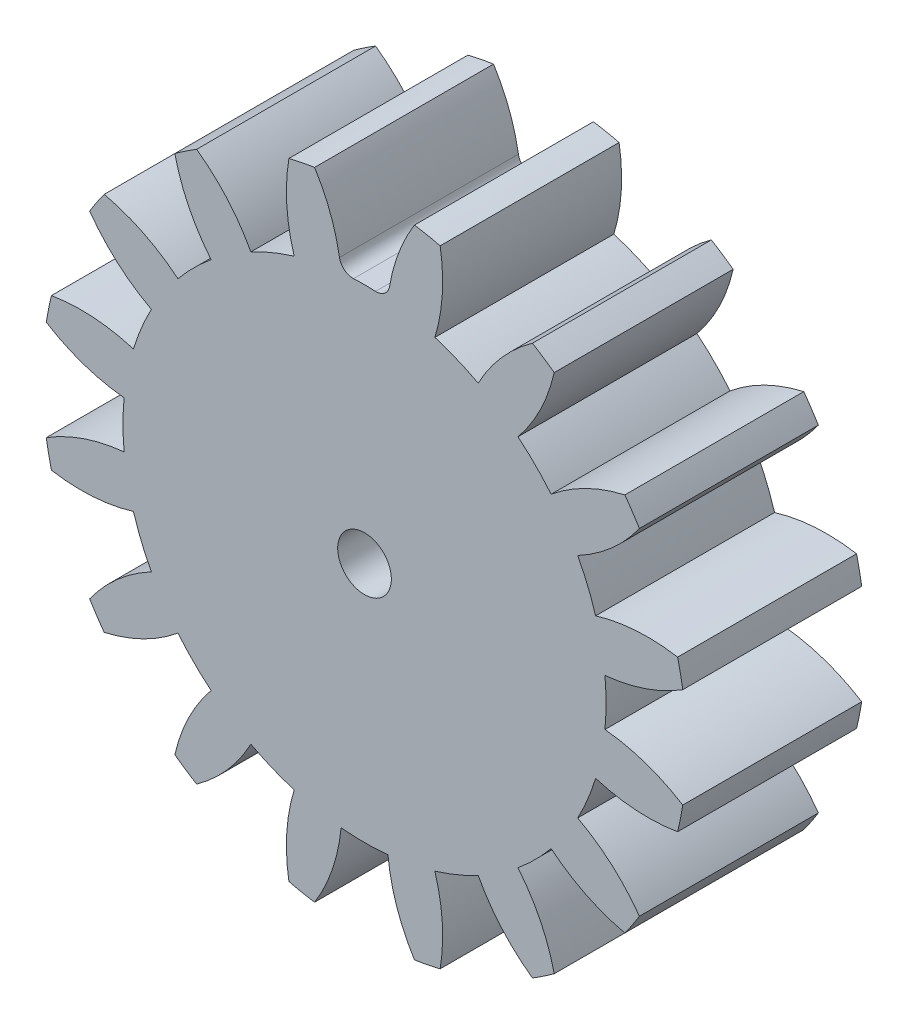
from build123d import *

# Parameters (mm, degrees)
SKETCH1_R           = 18
SKETCH1_R_2         = 1.5
BOSS_EXTRUDE1_DEPTH = 5
CUT_EXTRUDE1_DEPTH  = 26.942243542
FILLET1_R           = 0.76
CIRPATTERN3_COUNT   = 16


with BuildPart() as part:
    # Sketch1 → Boss-Extrude1 (new, symmetric)
    with BuildSketch(Plane.XY):
        Circle(SKETCH1_R)
        Circle(SKETCH1_R_2, mode=Mode.SUBTRACT)
    extrude(amount=BOSS_EXTRUDE1_DEPTH, both=True)

    # Sketch2 → Cut-Extrude1 (cut, symmetric)
    with BuildSketch(Plane.XY):
        with BuildLine():
            ThreePointArc((1.30964585, 13.436324935), (0, 13.5), (-1.30964585, 13.436324935))
            ThreePointArc((-1.30964585, 13.436324935), (-1.797691495, 15.695338881), (-2.790435992, 17.782392049))
            ThreePointArc((-2.790435992, 17.782392049), (0, 18), (2.790435992, 17.782392049))
            ThreePointArc((2.790435992, 17.782392049), (1.797691495, 15.695338881), (1.30964585, 13.436324935))
        make_face()
    cut_extrude1 = extrude(amount=CUT_EXTRUDE1_DEPTH, both=True, mode=Mode.SUBTRACT)

    # Fillet1
    fillet1_edges = [part.edges().sort_by_distance(p)[0] for p in [
        (1.30964585, 13.436324935, 0),
        (-1.30964585, 13.436324935, 0),
    ]]
    fillet(fillet1_edges, radius=FILLET1_R)

    # CirPattern3: Cut-Extrude1 ×16 about axis
    cirpattern3_axis = Axis((0, 0, 5), (0, 0, -1))
    for i in range(1, CIRPATTERN3_COUNT):
        add(cut_extrude1.rotate(cirpattern3_axis, i * 360 / CIRPATTERN3_COUNT), mode=Mode.SUBTRACT)


solid = part.part
